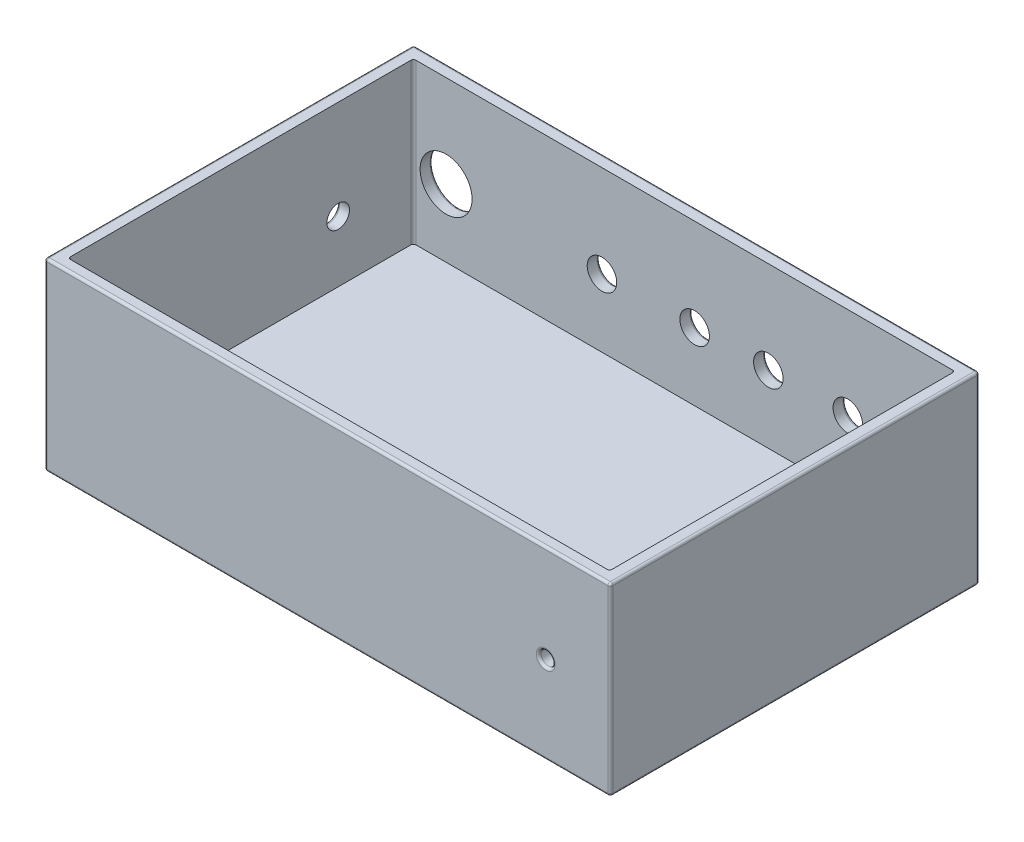
from build123d import *

# Parameters (mm, degrees)
SKETCH1_W           = 230
SKETCH1_H           = 150
BOSS_EXTRUDE8_DEPTH = 10
SKETCH7_W           = 230
SKETCH7_H           = 150
SKETCH7_W_2         = 220.095657342
SKETCH7_H_2         = 140.355303728
BOSS_EXTRUDE9_DEPTH = 65
FILLET5_R           = 1
FILLET6_R           = 1
FILLET7_R           = 1
FILLET8_R           = 1
FILLET9_R           = 1
SKETCH11_R          = 6
CUT_EXTRUDE1_DEPTH  = 10
SKETCH8_R           = 10.563925866
CUT_EXTRUDE2_DEPTH  = 10
SKETCH12_R          = 4.59000459
CUT_EXTRUDE4_DEPTH  = 10
SKETCH13_R          = 2.847987365
CUT_EXTRUDE5_DEPTH  = 10
FILLET1_R           = 1
FILLET2_R           = 1
FILLET4_R           = 1


with BuildPart() as part:
    # Sketch1 → Boss-Extrude8 (new body)
    with BuildSketch(Plane(origin=(0, 0, 0), x_dir=(1, 0, 0), z_dir=(0, 1, 0))):
        with Locations((115, 75)):
            Rectangle(SKETCH1_W, SKETCH1_H)
    extrude(amount=BOSS_EXTRUDE8_DEPTH)

    # Sketch7 → Boss-Extrude9 (add)
    with BuildSketch(Plane(origin=(0, 10, 0), x_dir=(1, 0, 0), z_dir=(0, 1, 0))):
        with Locations((115, 75)):
            Rectangle(SKETCH7_W, SKETCH7_H)
        with Locations((115, 74.795816205)):
            Rectangle(SKETCH7_W_2, SKETCH7_H_2, mode=Mode.SUBTRACT)
    extrude(amount=BOSS_EXTRUDE9_DEPTH)

    # Fillet5
    fillet5_edges = [part.edges().sort_by_distance(p)[0] for p in [
        (0, 37.5, 0),
        (0, 37.5, -150),
        (230, 37.5, 0),
        (230, 37.5, -150),
    ]]
    fillet(fillet5_edges, radius=FILLET5_R)

    # Fillet6
    fillet6_edges = [part.edges().sort_by_distance(p)[0] for p in [
        (4.952171329, 42.5, -144.973468069),
    ]]
    fillet(fillet6_edges, radius=FILLET6_R)

    # Fillet7
    fillet7_edges = [part.edges().sort_by_distance(p)[0] for p in [
        (225.047828671, 42.5, -4.618164341),
    ]]
    fillet(fillet7_edges, radius=FILLET7_R)

    # Fillet8
    fillet8_edges = [part.edges().sort_by_distance(p)[0] for p in [
        (225.047828671, 42.5, -144.973468069),
    ]]
    fillet(fillet8_edges, radius=FILLET8_R)

    # Fillet9
    fillet9_edges = [part.edges().sort_by_distance(p)[0] for p in [
        (4.952171329, 42.5, -4.618164341),
    ]]
    fillet(fillet9_edges, radius=FILLET9_R)

    # Sketch11 → Cut-Extrude1 (cut)
    with BuildSketch(Plane(origin=(0, 0, -150), x_dir=(-1, 0, 0), z_dir=(0, 0, -1))):
        with Locations((-213.691076878, 37.5)):
            Circle(SKETCH11_R)
        with Locations((-181.522077499, 37.5)):
            Circle(SKETCH11_R)
        with Locations((-149.219494891, 37.5)):
            Circle(SKETCH11_R)
        with Locations((-119.254790199, 37.5)):
            Circle(SKETCH11_R)
        with Locations((-81.591216293, 37.5)):
            Circle(SKETCH11_R)
    extrude(amount=-CUT_EXTRUDE1_DEPTH, mode=Mode.SUBTRACT)

    # Sketch8 → Cut-Extrude2 (cut)
    with BuildSketch(Plane(origin=(0, 0, -150), x_dir=(-1, 0, 0), z_dir=(0, 0, -1))):
        with Locations((-18.228247458, 37.5)):
            Circle(SKETCH8_R)
    extrude(amount=-CUT_EXTRUDE2_DEPTH, mode=Mode.SUBTRACT)

    # Sketch12 → Cut-Extrude4 (cut)
    with BuildSketch(Plane.ZY):
        with Locations((-114.397539398, 34.822497322)):
            Circle(SKETCH12_R)
    extrude(amount=-CUT_EXTRUDE4_DEPTH, mode=Mode.SUBTRACT)

    # Sketch13 → Cut-Extrude5 (cut)
    with BuildSketch(Plane.XY):
        with Locations((203.697724743, 35.479632118)):
            Circle(SKETCH13_R)
    extrude(amount=-CUT_EXTRUDE5_DEPTH, mode=Mode.SUBTRACT)

    # Fillet1
    fillet1_edges = [part.edges().sort_by_distance(p)[0] for p in [
        (0, 75, -75),
        (0, 0, -75),
        (0.292893219, 75, -149.707106781),
        (115, 75, -150),
        (229.707106781, 75, -149.707106781),
        (230, 75, -75),
        (229.707106781, 75, -0.292893219),
        (115, 75, 0),
        (0.292893219, 75, -0.292893219),
        (0.292893219, 0, -149.707106781),
        (115, 0, -150),
        (229.707106781, 0, -149.707106781),
        (230, 0, -75),
        (229.707106781, 0, -0.292893219),
        (115, 0, 0),
        (0.292893219, 0, -0.292893219),
        (0, 34.822497322, -118.987543988),
    ]]
    fillet(fillet1_edges, radius=FILLET1_R)

    # Fillet2
    fillet2_edges = [part.edges().sort_by_distance(p)[0] for p in [
        (200.849737378, 35.479632118, 0),
    ]]
    fillet(fillet2_edges, radius=FILLET2_R)

    # Fillet4
    fillet4_edges = [part.edges().sort_by_distance(p)[0] for p in [
        (155.219494891, 37.5, -150),
        (219.691076878, 37.5, -150),
        (187.522077499, 37.5, -150),
        (87.591216293, 37.5, -150),
        (125.254790199, 37.5, -150),
        (28.792173324, 37.5, -150),
    ]]
    fillet(fillet4_edges, radius=FILLET4_R)


solid = part.part
